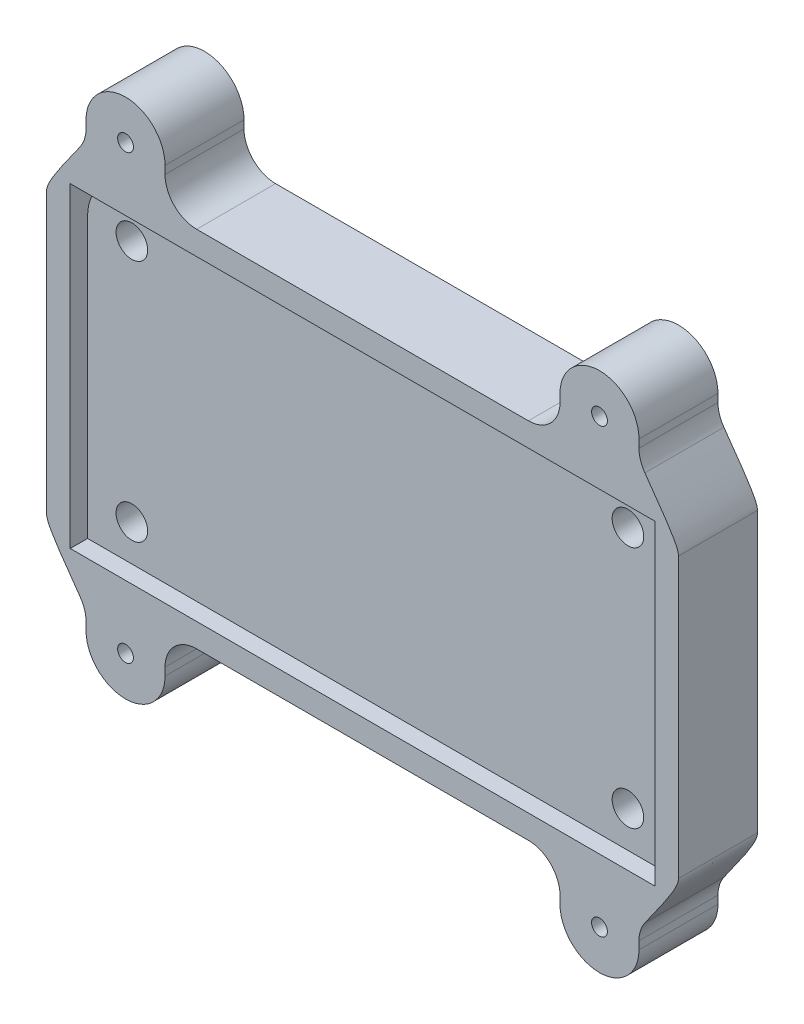
from build123d import *

# Parameters (mm, degrees)
SKETCH_2_W             = 40
SKETCH_2_H             = 23
SKETCH_2_R             = 1
EXTRUDE_1815_DEPTH     = 5
SKETCH_3_W             = 37
SKETCH_3_H             = 20
CUT_EXTRUDE_2215_DEPTH = 3
SKETCH_4_R             = 1
EXTRUDE_2889_DEPTH     = 1.9
SKETCH_10_R            = 0.5
EXTRUDE_4733_DEPTH     = 5
FILLET_START           = -1
FILLET_5_DEPTH         = 7
FILLET_6_DEPTH         = 7
CUT_EXTRUDE_7304_DEPTH = 1.1


with BuildPart() as part:
    # Эскиз2 → Extrude 1815 (new body)
    with BuildSketch(Plane.XY):
        Rectangle(SKETCH_2_W, SKETCH_2_H)
        with Locations((15.7, -7.7)):
            Circle(SKETCH_2_R, mode=Mode.SUBTRACT)
        with Locations((-15.7, 7.7)):
            Circle(SKETCH_2_R, mode=Mode.SUBTRACT)
        with Locations((15.7, 7.7)):
            Circle(SKETCH_2_R, mode=Mode.SUBTRACT)
        with Locations((-15.7, -7.7)):
            Circle(SKETCH_2_R, mode=Mode.SUBTRACT)
    extrude(amount=EXTRUDE_1815_DEPTH)

    # Эскиз3 → Cut-Extrude 2215 (cut)
    with BuildSketch(Plane.XY.offset(5)):
        Rectangle(SKETCH_3_W, SKETCH_3_H)
    extrude(amount=-CUT_EXTRUDE_2215_DEPTH, mode=Mode.SUBTRACT)

    # Эскиз4 → Extrude 2889 (add)
    with BuildSketch(Plane.XY.offset(2)):
        with BuildLine():
            ThreePointArc((-17.296871942, 10), (-18.181052341, 8.997836384), (-18.5, 7.7))
            Line((-18.5, 7.7), (-18.5, -10))
            Line((-18.5, -10), (18.5, -10))
            Line((18.5, -10), (18.5, 10))
            Line((18.5, 10), (-17.296871942, 10))
        make_face()
        with Locations((-15.7, 7.7)):
            Circle(SKETCH_4_R, mode=Mode.SUBTRACT)
        with Locations((15.7, -7.7)):
            Circle(SKETCH_4_R, mode=Mode.SUBTRACT)
        with Locations((15.7, 7.7)):
            Circle(SKETCH_4_R, mode=Mode.SUBTRACT)
        with Locations((-15.7, -7.7)):
            Circle(SKETCH_4_R, mode=Mode.SUBTRACT)
    extrude(amount=EXTRUDE_2889_DEPTH)

    # Эскиз10 → Extrude 4733 (add)
    # profile 1 of 4: a face of its own
    with BuildSketch(Plane(origin=(0, 0, 0), x_dir=(-1, 0, 0), z_dir=(0, 0, -1))):
        with BuildLine():
            Line((-17.5, 14), (-17.5, 13.5))
            ThreePointArc((-17.5, 13.5), (-18.085786438, 12.085786438), (-19.5, 11.5))
            Line((-19.5, 11.5), (-10.5, 11.5))
            ThreePointArc((-10.5, 11.5), (-11.914213562, 12.085786438), (-12.5, 13.5))
            Line((-12.5, 13.5), (-12.5, 14))
            ThreePointArc((-12.5, 14), (-15, 16.5), (-17.5, 14))
        make_face()
        with Locations((-15, 14)):
            Circle(SKETCH_10_R, mode=Mode.SUBTRACT)
    # profile 2 of 4: a face of its own
    with BuildSketch(Plane(origin=(0, 0, 0), x_dir=(-1, 0, 0), z_dir=(0, 0, -1))):
        with BuildLine():
            Line((10.5, 11.5), (19.5, 11.5))
            ThreePointArc((19.5, 11.5), (18.085786438, 12.085786438), (17.5, 13.5))
            Line((17.5, 13.5), (17.5, 14))
            ThreePointArc((17.5, 14), (15, 16.5), (12.5, 14))
            Line((12.5, 14), (12.5, 13.5))
            ThreePointArc((12.5, 13.5), (11.914213562, 12.085786438), (10.5, 11.5))
        make_face()
        with Locations(Location((15, 14, 0), (0, 0, 180))):
            Circle(SKETCH_10_R, mode=Mode.SUBTRACT)
    # profile 3 of 4: a face of its own
    with BuildSketch(Plane(origin=(0, 0, 0), x_dir=(-1, 0, 0), z_dir=(0, 0, -1))):
        with BuildLine():
            Line((17.5, -14), (17.5, -13.5))
            ThreePointArc((17.5, -13.5), (18.085786438, -12.085786438), (19.5, -11.5))
            Line((19.5, -11.5), (10.5, -11.5))
            ThreePointArc((10.5, -11.5), (11.914213562, -12.085786438), (12.5, -13.5))
            Line((12.5, -13.5), (12.5, -14))
            ThreePointArc((12.5, -14), (15, -16.5), (17.5, -14))
        make_face()
        with Locations((15, -14)):
            Circle(SKETCH_10_R, mode=Mode.SUBTRACT)
    # profile 4 of 4: a face of its own
    with BuildSketch(Plane(origin=(0, 0, 0), x_dir=(-1, 0, 0), z_dir=(0, 0, -1))):
        with BuildLine():
            Line((-10.5, -11.5), (-19.5, -11.5))
            ThreePointArc((-19.5, -11.5), (-18.085786438, -12.085786438), (-17.5, -13.5))
            Line((-17.5, -13.5), (-17.5, -14))
            ThreePointArc((-17.5, -14), (-15, -16.5), (-12.5, -14))
            Line((-12.5, -14), (-12.5, -13.5))
            ThreePointArc((-12.5, -13.5), (-11.914213562, -12.085786438), (-10.5, -11.5))
        make_face()
        with Locations(Location((-15, -14, 0), (0, 0, 180))):
            Circle(SKETCH_10_R, mode=Mode.SUBTRACT)
    extrude(amount=-EXTRUDE_4733_DEPTH)

    # Скругление5: read off the stored shape, not the designer's step
    # Скругление5 outline → Скругление5 (cut)
    with BuildSketch(Plane.XY.offset(FILLET_START)):
        with BuildLine():
            ThreePointArc((19.5, 11.5), (18.5867215, 11.720696097), (17.875, 12.334077619))
            add(Edge.make_bspline(
                [(17.875, 12.334077619), (20, 9.372366741), (20, 8.836310473)],
                knots=[0, 0, 0, 1, 1, 1], degree=2, weights=[1, 1.5, 1]))
            Line((20, 8.836310473), (20, 11.5))
            Line((20, 11.5), (19.5, 11.5))
        make_face()
        with BuildLine():
            ThreePointArc((-19.5, -11.5), (-18.5867215, -11.720696097), (-17.875, -12.334077619))
            add(Edge.make_bspline(
                [(-17.875, -12.334077619), (-20, -9.372366741), (-20, -8.836310473)],
                knots=[0, 0, 0, 1, 1, 1], degree=2, weights=[1, 1.5, 1]))
            Line((-20, -8.836310473), (-20, -11.5))
            Line((-20, -11.5), (-19.5, -11.5))
        make_face()
    extrude(amount=FILLET_5_DEPTH, mode=Mode.SUBTRACT)

    # Скругление6: read off the stored shape, not the designer's step
    # Скругление6 outline → Скругление6 (cut)
    with BuildSketch(Plane.XY.offset(FILLET_START)):
        with BuildLine():
            add(Edge.make_bspline(
                [(-17.875, 12.334077618), (-20, 9.372366741), (-20, 8.836310473)],
                knots=[0, 0, 0, 1, 1, 1], degree=2, weights=[1, 1.5, 1]))
            ThreePointArc((-17.875, 12.334077618), (-18.5867215, 11.720696097), (-19.5, 11.5))
            Line((-19.5, 11.5), (-20, 11.5))
            Line((-20, 11.5), (-20, 8.836310473))
        make_face()
        with BuildLine():
            add(Edge.make_bspline(
                [(17.875, -12.334077618), (20, -9.372366741), (20, -8.836310473)],
                knots=[0, 0, 0, 1, 1, 1], degree=2, weights=[1, 1.5, 1]))
            ThreePointArc((17.875, -12.334077618), (18.5867215, -11.720696097), (19.5, -11.5))
            Line((19.5, -11.5), (20, -11.5))
            Line((20, -11.5), (20, -8.836310473))
        make_face()
    extrude(amount=FILLET_6_DEPTH, mode=Mode.SUBTRACT)

    # Эскиз12 → Cut-Extrude 7304 (cut)
    with BuildSketch(Plane.XY.offset(5)):
        with BuildLine():
            Line((-5.593541674, 13.75), (-10.5, 13.75))
            ThreePointArc((-10.5, 13.75), (-11.076220456, 13.834805496), (-11.60357425, 14.082030014))
            ThreePointArc((-11.60357425, 14.082030014), (-8.693066451, 12.205329008), (-5.593541674, 13.75))
        make_face()
        with BuildLine():
            Line((3.993541674, -13.75), (9.806458326, -13.75))
            ThreePointArc((9.806458326, -13.75), (6.9, -12.2), (3.993541674, -13.75))
        make_face()
    extrude(amount=-CUT_EXTRUDE_7304_DEPTH, mode=Mode.SUBTRACT)


solid = part.part
